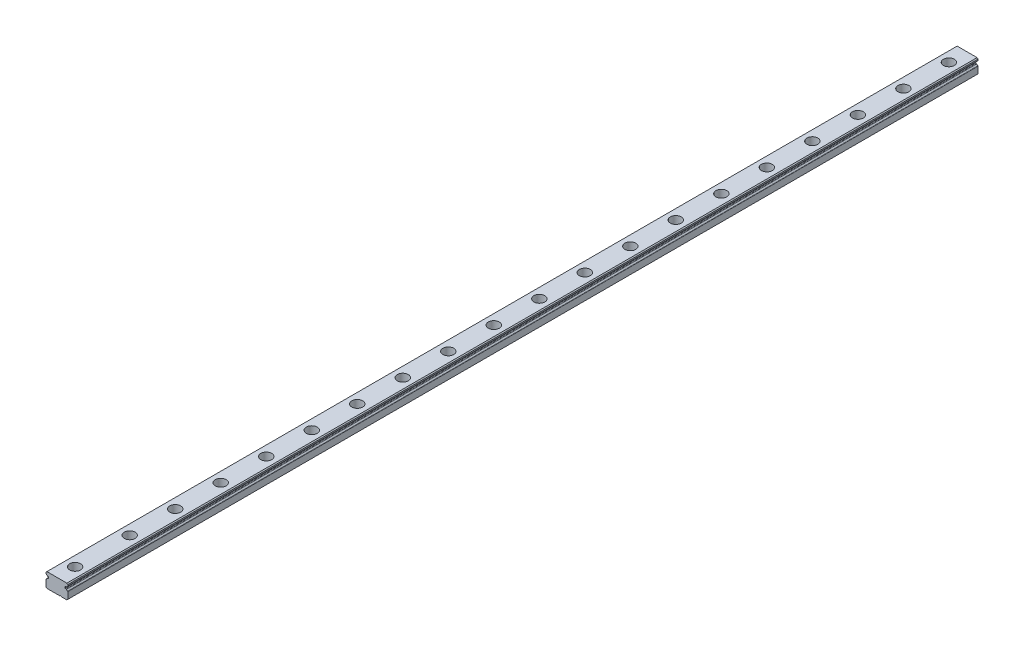
from build123d import *

# Parameters (mm, degrees)
EXTRUDE_RAIL_PROFILE_DEPTH     = 250
CBORE_FOR_M3_SHCS1_D           = 3.5
CBORE_FOR_M3_SHCS1_CBORE_D     = 6
CBORE_FOR_M3_SHCS1_CBORE_DEPTH = 4.5
FILL_START                     = -2.000000001
FILL_PATTERN_OUTLINE_R         = 3
FILL_PATTERN_DEPTH             = 4.5
FILL_START_2                   = -5.5
FILL_PATTERN_2_OUTLINE_R       = 1.75
FILL_PATTERN_2_DEPTH           = 3.499999999


# Read off the part's stored shape, not the designer's step: Fill Pattern
with BuildPart() as part:
    # Sketch1 → Extrude Rail Profile (new, symmetric)
    with BuildSketch(Plane.XY):
        with BuildLine():
            Line((-5.982334879, -1.370069213), (-5.982334879, -5.001472146))
            Line((-5.982334879, -5.001472146), (-5.483807025, -5.499999999))
            Line((-5.483807025, -5.499999999), (1.595289228, -5.499999999))
            ThreePointArc((1.595289228, -5.499999999), (1.994111552, -5.300588838), (2.392933875, -5.5))
            Line((2.392933875, -5.5), (5.483807024, -5.5))
            Line((5.483807024, -5.5), (5.982334878, -5.001472147))
            Line((5.982334878, -5.001472147), (5.982334878, -1.370069213))
            ThreePointArc((5.982334878, -1.370069213), (5.940056641, -1.231182813), (5.82756375, -1.139410101))
            ThreePointArc((5.82756375, -1.139410101), (5.497041405, -0.930122348), (5.251697363, -0.625405104))
            ThreePointArc((5.251697363, -0.625405104), (5.169975597, -0.541388466), (5.058890009, -0.504008866))
            Line((5.058890009, -0.504008866), (4.71429032, -0.473860299))
            ThreePointArc((4.71429032, -0.473860299), (4.552238438, -0.393945155), (4.486751147, -0.225544865))
            Line((4.486751147, -0.225544865), (4.486751147, 0.225544865))
            ThreePointArc((4.486751147, 0.225544865), (4.552238438, 0.393945155), (4.71429032, 0.473860299))
            Line((4.71429032, 0.473860299), (5.079776582, 0.505836204))
            ThreePointArc((5.079776582, 0.505836204), (5.187925163, 0.5413949), (5.268982803, 0.621333598))
            ThreePointArc((5.268982803, 0.621333598), (5.511607978, 0.899707672), (5.82756375, 1.09083865))
            ThreePointArc((5.82756375, 1.09083865), (5.940040963, 1.182638806), (5.982312115, 1.321532803))
            Line((5.982312115, 1.321532803), (5.982321902, 2.00145917))
            Line((5.982321902, 2.00145917), (5.483807025, 2.499999999))
            Line((5.483807025, 2.499999999), (-5.483807026, 2.499999999))
            Line((-5.483807026, 2.499999999), (-5.982321903, 2.00145917))
            Line((-5.982321903, 2.00145917), (-5.982321903, 1.32884687))
            ThreePointArc((-5.982321903, 1.32884687), (-5.942177076, 1.185718341), (-5.827697321, 1.090893402))
            ThreePointArc((-5.827697321, 1.090893402), (-5.511663234, 0.899754111), (-5.268982805, 0.621333597))
            ThreePointArc((-5.268982805, 0.621333597), (-5.187925164, 0.541394898), (-5.079776582, 0.505836204))
            Line((-5.079776582, 0.505836204), (-4.71429032, 0.473860299))
            ThreePointArc((-4.71429032, 0.473860299), (-4.552238438, 0.393945155), (-4.486751147, 0.225544865))
            Line((-4.486751147, 0.225544865), (-4.486751147, -0.225544865))
            ThreePointArc((-4.486751147, -0.225544865), (-4.552238438, -0.393945155), (-4.71429032, -0.473860299))
            Line((-4.71429032, -0.473860299), (-5.058890009, -0.504008866))
            ThreePointArc((-5.058890009, -0.504008866), (-5.169975597, -0.541388466), (-5.251697363, -0.625405104))
            ThreePointArc((-5.251697363, -0.625405104), (-5.499180752, -0.921502608), (-5.828043428, -1.123421157))
            ThreePointArc((-5.828043428, -1.123421157), (-5.944906256, -1.221900029), (-5.982334879, -1.370069213))
        make_face()
    extrude(amount=EXTRUDE_RAIL_PROFILE_DEPTH, both=True)

    # CBORE for M3 SHCS1 (through all)
    with Locations(Plane(origin=(0, 2.499999999, 0), x_dir=(1, 0, 0), z_dir=(0, 1, 0))):
        with Locations((0, 240)):
            cbore_for_m3_shcs1 = CounterBoreHole(CBORE_FOR_M3_SHCS1_D / 2, CBORE_FOR_M3_SHCS1_CBORE_D / 2, CBORE_FOR_M3_SHCS1_CBORE_DEPTH)

    # M3 End Mirror: CBORE for M3 SHCS1 across plane
    add(cbore_for_m3_shcs1.mirror(Plane.XY), mode=Mode.SUBTRACT)

    # Fill Pattern outline → Fill Pattern (cut)
    with BuildSketch(Plane(origin=(0, 0, 0), x_dir=(1, 0, 0), z_dir=(0, 1, 0)).offset(FILL_START)):
        with Locations((0, 215)):
            Circle(FILL_PATTERN_OUTLINE_R)
        with Locations((0, 190)):
            Circle(FILL_PATTERN_OUTLINE_R)
        with Locations((0, 165)):
            Circle(FILL_PATTERN_OUTLINE_R)
        with Locations((0, 140)):
            Circle(FILL_PATTERN_OUTLINE_R)
        with Locations((0, 115)):
            Circle(FILL_PATTERN_OUTLINE_R)
        with Locations((0, 90)):
            Circle(FILL_PATTERN_OUTLINE_R)
        with Locations((0, 65)):
            Circle(FILL_PATTERN_OUTLINE_R)
        with Locations((0, 40)):
            Circle(FILL_PATTERN_OUTLINE_R)
        with Locations((0, 15)):
            Circle(FILL_PATTERN_OUTLINE_R)
        with Locations((0, -10)):
            Circle(FILL_PATTERN_OUTLINE_R)
        with Locations((0, -35)):
            Circle(FILL_PATTERN_OUTLINE_R)
        with Locations((0, -60)):
            Circle(FILL_PATTERN_OUTLINE_R)
        with Locations((0, -85)):
            Circle(FILL_PATTERN_OUTLINE_R)
        with Locations((0, -110)):
            Circle(FILL_PATTERN_OUTLINE_R)
        with Locations((0, -135)):
            Circle(FILL_PATTERN_OUTLINE_R)
        with Locations((0, -160)):
            Circle(FILL_PATTERN_OUTLINE_R)
        with Locations((0, -185)):
            Circle(FILL_PATTERN_OUTLINE_R)
        with Locations((0, -210)):
            Circle(FILL_PATTERN_OUTLINE_R)
    extrude(amount=FILL_PATTERN_DEPTH, mode=Mode.SUBTRACT)

    # Fill Pattern 2 outline → Fill Pattern 2 (cut)
    with BuildSketch(Plane(origin=(0, 0, 0), x_dir=(1, 0, 0), z_dir=(0, 1, 0)).offset(FILL_START_2)):
        with Locations((0, 215)):
            Circle(FILL_PATTERN_2_OUTLINE_R)
        with Locations((0, 190)):
            Circle(FILL_PATTERN_2_OUTLINE_R)
        with Locations((0, 165)):
            Circle(FILL_PATTERN_2_OUTLINE_R)
        with Locations((0, 140)):
            Circle(FILL_PATTERN_2_OUTLINE_R)
        with Locations((0, 115)):
            Circle(FILL_PATTERN_2_OUTLINE_R)
        with Locations((0, 90)):
            Circle(FILL_PATTERN_2_OUTLINE_R)
        with Locations((0, 65)):
            Circle(FILL_PATTERN_2_OUTLINE_R)
        with Locations((0, 40)):
            Circle(FILL_PATTERN_2_OUTLINE_R)
        with Locations((0, 15)):
            Circle(FILL_PATTERN_2_OUTLINE_R)
        with Locations((0, -10)):
            Circle(FILL_PATTERN_2_OUTLINE_R)
        with Locations((0, -35)):
            Circle(FILL_PATTERN_2_OUTLINE_R)
        with Locations((0, -60)):
            Circle(FILL_PATTERN_2_OUTLINE_R)
        with Locations((0, -85)):
            Circle(FILL_PATTERN_2_OUTLINE_R)
        with Locations((0, -110)):
            Circle(FILL_PATTERN_2_OUTLINE_R)
        with Locations((0, -135)):
            Circle(FILL_PATTERN_2_OUTLINE_R)
        with Locations((0, -160)):
            Circle(FILL_PATTERN_2_OUTLINE_R)
        with Locations((0, -185)):
            Circle(FILL_PATTERN_2_OUTLINE_R)
        with Locations((0, -210)):
            Circle(FILL_PATTERN_2_OUTLINE_R)
    extrude(amount=FILL_PATTERN_2_DEPTH, mode=Mode.SUBTRACT)


solid = part.part
